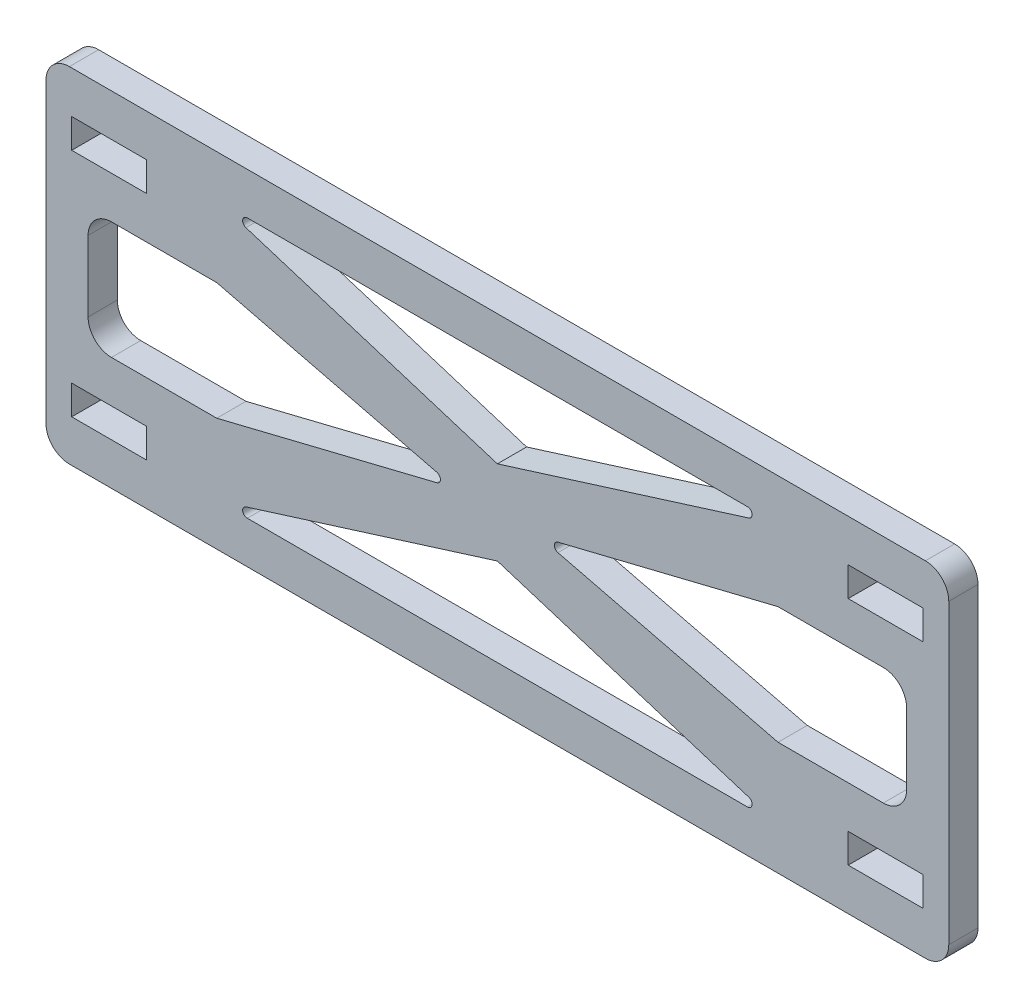
from build123d import *

# Parameters (mm, degrees)
SKETCH1_W           = 49.022
SKETCH1_H           = 18.6944
SKETCH1_W_2         = 4.064
SKETCH1_H_2         = 1.5875
BOSS_EXTRUDE1_DEPTH = 1.5875
CUT_EXTRUDE1_REACH  = 53.735
FILLET1_R           = 0.254
FILLET2_R           = 1.27


with BuildPart() as part:
    # Sketch1 → Boss-Extrude1 (new body)
    with BuildSketch(Plane.XY.offset(56.947143149)):
        with Locations((11.232994638, 28.020399012)):
            Rectangle(SKETCH1_W, SKETCH1_H)
        with Locations((-9.849005362, 34.287849012)):
            Rectangle(SKETCH1_W_2, SKETCH1_H_2, mode=Mode.SUBTRACT)
        with Locations((32.314994638, 34.287849012)):
            Rectangle(SKETCH1_W_2, SKETCH1_H_2, mode=Mode.SUBTRACT)
        with Locations((-9.849005362, 21.752949012)):
            Rectangle(SKETCH1_W_2, SKETCH1_H_2, mode=Mode.SUBTRACT)
        with Locations((32.314994638, 21.752949012)):
            Rectangle(SKETCH1_W_2, SKETCH1_H_2, mode=Mode.SUBTRACT)
    extrude(amount=BOSS_EXTRUDE1_DEPTH)

    # Sketch3 → Cut-Extrude1 (cut, up to next)
    with BuildSketch(Plane.XY.offset(58.534643149), mode=Mode.PRIVATE) as cut_extrude1_sk1:
        Polygon((26.472879762, 35.081599012), (-4.006890486, 35.081599012), (11.232994638, 30.306399012), align=None)
    cut_extrude1_tool1 = extrude(cut_extrude1_sk1.sketch, amount=-CUT_EXTRUDE1_REACH, mode=Mode.PRIVATE) & part.part
    # Sketch3 → Cut-Extrude1 (cut, up to next)
    with BuildSketch(Plane.XY.offset(58.534643149), mode=Mode.PRIVATE) as cut_extrude1_sk2:
        Polygon((-4.006890486, 20.959199012), (26.472879762, 20.959199012), (11.232994638, 25.734399012), align=None)
    cut_extrude1_tool2 = extrude(cut_extrude1_sk2.sketch, amount=-CUT_EXTRUDE1_REACH, mode=Mode.PRIVATE) & part.part
    # Sketch3 → Cut-Extrude1 (cut, up to next)
    with BuildSketch(Plane.XY.offset(58.534643149), mode=Mode.PRIVATE) as cut_extrude1_sk3:
        Polygon((8.946994638, 28.020399012), (-4.006890486, 31.208099012), (-10.992005362, 31.208099012), (-10.992005362, 24.832699012), (-4.006890486, 24.832699012), align=None)
    cut_extrude1_tool3 = extrude(cut_extrude1_sk3.sketch, amount=-CUT_EXTRUDE1_REACH, mode=Mode.PRIVATE) & part.part
    # Sketch3 → Cut-Extrude1 (cut, up to next)
    with BuildSketch(Plane.XY.offset(58.534643149), mode=Mode.PRIVATE) as cut_extrude1_sk4:
        Polygon((13.518994638, 28.020399012), (26.472879762, 24.832699012), (33.457994638, 24.832699012), (33.457994638, 31.208099012), (26.472879762, 31.208099012), align=None)
    cut_extrude1_tool4 = extrude(cut_extrude1_sk4.sketch, amount=-CUT_EXTRUDE1_REACH, mode=Mode.PRIVATE) & part.part
    add(cut_extrude1_tool1.solids().sort_by_distance((11.232995, 33.489866, 58.534643))[0], mode=Mode.SUBTRACT)
    add(cut_extrude1_tool2.solids().sort_by_distance((11.232995, 22.550932, 58.534643))[0], mode=Mode.SUBTRACT)
    add(cut_extrude1_tool3.solids().sort_by_distance((-3.741606, 28.020399, 58.534643))[0], mode=Mode.SUBTRACT)
    add(cut_extrude1_tool4.solids().sort_by_distance((26.207595, 28.020399, 58.534643))[0], mode=Mode.SUBTRACT)

    # Fillet1
    fillet1_edges = [part.edges().sort_by_distance(p)[0] for p in [
        (26.472879762, 35.081599012, 57.740893149),
        (-4.006890486, 35.081599012, 57.740893149),
        (-4.006890486, 20.959199012, 57.740893149),
        (26.472879762, 20.959199012, 57.740893149),
        (8.946994638, 28.020399012, 57.740893149),
        (13.518994638, 28.020399012, 57.740893149),
    ]]
    fillet(fillet1_edges, radius=FILLET1_R)

    # Fillet2
    fillet2_edges = [part.edges().sort_by_distance(p)[0] for p in [
        (33.457994638, 24.832699012, 57.740893149),
        (33.457994638, 31.208099012, 57.740893149),
        (-10.992005362, 31.208099012, 57.740893149),
        (-10.992005362, 24.832699012, 57.740893149),
        (-13.278005362, 18.673199012, 57.740893149),
        (-13.278005362, 37.367599012, 57.740893149),
        (35.743994638, 37.367599012, 57.740893149),
        (35.743994638, 18.673199012, 57.740893149),
    ]]
    fillet(fillet2_edges, radius=FILLET2_R)


solid = part.part
